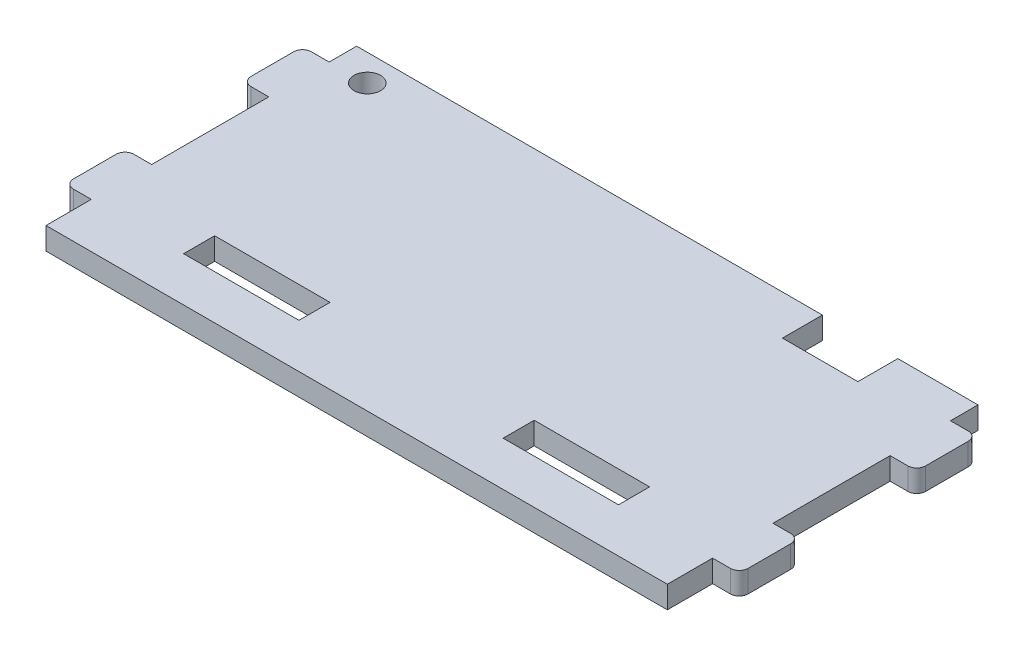
from build123d import *

# Parameters (mm, degrees)
SKETCH_1_W          = 76
SKETCH_1_H          = 35
EXTRUDE_1_DEPTH     = 2.5
SKETCH_2_W          = 13
SKETCH_2_H          = 3.5
CUT_EXTRUDE_1_DEPTH = 42.910619179
SKETCH_3_W          = 3
SKETCH_3_H          = 5.1
SKETCH_3_H_2        = 3.1
SKETCH_3_H_3        = 13.2
CUT_EXTRUDE_2_DEPTH = 42.910619179
FILLET_1_R          = 1
SKETCH_4_R          = 1.5
SKETCH_4_W          = 8.5
SKETCH_4_H          = 4.5
CUT_EXTRUDE_3_DEPTH = 42.910619179


with BuildPart() as part:
    # 草图1 → 凸台-拉伸1 (new body)
    with BuildSketch(Plane(origin=(0, 0, 0), x_dir=(1, 0, 0), z_dir=(0, 1, 0))):
        Rectangle(SKETCH_1_W, SKETCH_1_H)
    extrude(amount=EXTRUDE_1_DEPTH)

    # 草图2 → 切除-拉伸1 (cut, through all)
    with BuildSketch(Plane(origin=(0, 2.5, 0), x_dir=(1, 0, 0), z_dir=(0, 1, 0))):
        with Locations((-18, -10.75)):
            Rectangle(SKETCH_2_W, SKETCH_2_H)
        with Locations((18, -10.75)):
            Rectangle(SKETCH_2_W, SKETCH_2_H)
    extrude(amount=-CUT_EXTRUDE_1_DEPTH, mode=Mode.SUBTRACT)

    # 草图3 → 切除-拉伸2 (cut, through all)
    with BuildSketch(Plane(origin=(0, 2.5, 0), x_dir=(1, 0, 0), z_dir=(0, 1, 0))):
        with Locations((-36.5, -14.95)):
            Rectangle(SKETCH_3_W, SKETCH_3_H)
        with Locations((-36.5, 15.95)):
            Rectangle(SKETCH_3_W, SKETCH_3_H_2)
        with Locations((-36.5, 1)):
            Rectangle(SKETCH_3_W, SKETCH_3_H_3)
        with Locations((36.5, -14.95)):
            Rectangle(SKETCH_3_W, SKETCH_3_H)
        with Locations((36.5, 1)):
            Rectangle(SKETCH_3_W, SKETCH_3_H_3)
        with Locations((36.5, 15.95)):
            Rectangle(SKETCH_3_W, SKETCH_3_H_2)
    extrude(amount=-CUT_EXTRUDE_2_DEPTH, mode=Mode.SUBTRACT)

    # 圆角1
    fillet_1_edges = [part.edges().sort_by_distance(p)[0] for p in [
        (38, 1.25, -14.4),
        (38, 1.25, -7.6),
        (38, 1.25, 5.6),
        (38, 1.25, 12.4),
        (-38, 1.25, 12.4),
        (-38, 1.25, 5.6),
        (-38, 1.25, -7.6),
        (-38, 1.25, -14.4),
    ]]
    fillet(fillet_1_edges, radius=FILLET_1_R)

    # 草图4 → 切除-拉伸3 (cut, through all)
    with BuildSketch(Plane(origin=(0, 2.5, 0), x_dir=(1, 0, 0), z_dir=(0, 1, 0))):
        with Locations((-30.8, 14.5)):
            Circle(SKETCH_4_R)
        with Locations((21.718135054, 15.25)):
            Rectangle(SKETCH_4_W, SKETCH_4_H)
    extrude(amount=-CUT_EXTRUDE_3_DEPTH, mode=Mode.SUBTRACT)


solid = part.part
